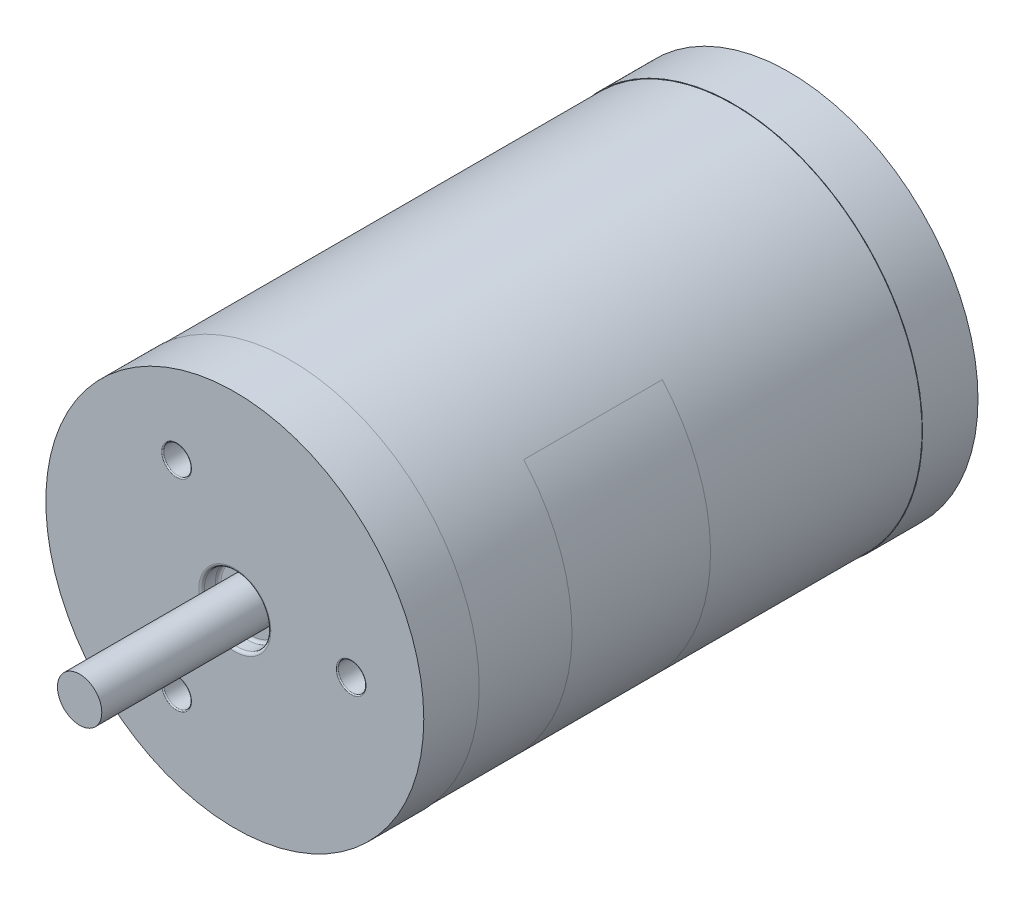
from build123d import *

# Parameters (mm, degrees)
CROQUIS1_R                 = 34
SALIENTE_EXTRUIR1_DEPTH    = 50
CROQUIS2_R                 = 4
SALIENTE_EXTRUIR2_DEPTH    = 28
CROQUIS3_R                 = 2.5
CORTAR_EXTRUIR1_DEPTH      = 5
CROQUIS4_R                 = 15
SALIENTE_EXTRUIR3_DEPTH    = 10.5
CROQUIS5_R                 = 2
CORTAR_EXTRUIR2_DEPTH      = 10.5
CROQUIS6_R                 = 34.1
CROQUIS6_R_2               = 2.5
SALIENTE_EXTRUIR4_DEPTH    = 10
REDONDEO1_R                = 1
CORTAR_EXTRUIR3_DEPTH      = 5
CORTAR_EXTRUIR3_DEPTH_BACK = 5
CROQUIS8_W                 = 18.660748896
CROQUIS8_H                 = 10.045403252
CROQUIS9_R                 = 2
CORTAR_EXTRUIR4_DEPTH      = 5
CORTAR_EXTRUIR5_START      = -3
CROQUIS10_R                = 6
CROQUIS10_R_2              = 4
CORTAR_EXTRUIR5_DEPTH      = 3
REDONDEO2_R                = 0.5
REDONDEO3_R                = 0.5
REDONDEO4_R                = 0.2


with BuildPart() as part:
    # Croquis1 → Saliente-Extruir1 (new, symmetric)
    with BuildSketch(Plane.XY):
        Circle(CROQUIS1_R)
    extrude(amount=SALIENTE_EXTRUIR1_DEPTH, both=True)

    # Croquis2 → Saliente-Extruir2 (add)
    with BuildSketch(Plane.XY.offset(50)):
        Circle(CROQUIS2_R)
    extrude(amount=SALIENTE_EXTRUIR2_DEPTH)

    # Croquis3 → Cortar-Extruir1 (cut)
    with BuildSketch(Plane.XY.offset(50)):
        with Locations((21, 0)):
            Circle(CROQUIS3_R)
        with Locations((-10.5, -18.186533479)):
            Circle(CROQUIS3_R)
        with Locations((-10.5, 18.186533479)):
            Circle(CROQUIS3_R)
    extrude(amount=-CORTAR_EXTRUIR1_DEPTH, mode=Mode.SUBTRACT)

    # Croquis4 → Saliente-Extruir3 (add)
    with BuildSketch(Plane(origin=(0, 0, -50), x_dir=(-1, 0, 0), z_dir=(0, 0, -1))):
        Circle(CROQUIS4_R)
    extrude(amount=SALIENTE_EXTRUIR3_DEPTH)

    # Croquis5 → Cortar-Extruir2 (cut)
    with BuildSketch(Plane(origin=(0, 0, -50), x_dir=(-1, 0, 0), z_dir=(0, 0, -1))):
        with Locations((-30, 0)):
            Circle(CROQUIS5_R)
        with Locations((30, 0)):
            Circle(CROQUIS5_R)
    extrude(amount=-CORTAR_EXTRUIR2_DEPTH, mode=Mode.SUBTRACT)

    # Croquis6 → Saliente-Extruir4 (add)
    with BuildSketch(Plane.XY.offset(50)):
        Circle(CROQUIS6_R)
        with Locations((21, 0)):
            Circle(CROQUIS6_R_2, mode=Mode.SUBTRACT)
        with Locations((-10.5, -18.186533479)):
            Circle(CROQUIS6_R_2, mode=Mode.SUBTRACT)
        with Locations((-10.5, 18.186533479)):
            Circle(CROQUIS6_R_2, mode=Mode.SUBTRACT)
    saliente_extruir4 = extrude(amount=-SALIENTE_EXTRUIR4_DEPTH)

    # Simetría1: Saliente-Extruir4 across plane
    add(saliente_extruir4.mirror(Plane.XY))

    # Redondeo1
    redondeo1_edges = [part.edges().sort_by_distance(p)[0] for p in [
        (15, 0, -60.5),
    ]]
    fillet(redondeo1_edges, radius=REDONDEO1_R)

    # Croquis8 → Cortar-Extruir3 (cut, two sides: drawn at the far end of the back side and taken through both)
    with BuildSketch(Plane(origin=(0, -34, 0), x_dir=(-1, 0, 0), z_dir=(0, -1, 0)).offset(-CORTAR_EXTRUIR3_DEPTH_BACK)):
        with Locations((0, -38.527445352)):
            Rectangle(CROQUIS8_W, CROQUIS8_H)
    extrude(amount=CORTAR_EXTRUIR3_DEPTH + CORTAR_EXTRUIR3_DEPTH_BACK, mode=Mode.SUBTRACT)

    # Croquis9 → Cortar-Extruir4 (cut)
    with BuildSketch(Plane(origin=(0, 0, -50), x_dir=(-1, 0, 0), z_dir=(0, 0, -1))):
        with Locations((30, 0)):
            Circle(CROQUIS9_R)
        with Locations((-30, 0)):
            Circle(CROQUIS9_R)
    extrude(amount=-CORTAR_EXTRUIR4_DEPTH, mode=Mode.SUBTRACT)

    # Croquis10 → Cortar-Extruir5 (cut)
    with BuildSketch(Plane.XY.offset(50).offset(CORTAR_EXTRUIR5_START)):
        Circle(CROQUIS10_R)
        Circle(CROQUIS10_R_2, mode=Mode.SUBTRACT)
    extrude(amount=CORTAR_EXTRUIR5_DEPTH, mode=Mode.SUBTRACT)

    # Redondeo2
    redondeo2_edges = [part.edges().sort_by_distance(p)[0] for p in [
        (-6, 0, 50),
    ]]
    fillet(redondeo2_edges, radius=REDONDEO2_R)

    # Redondeo3
    redondeo3_edges = [part.edges().sort_by_distance(p)[0] for p in [
        (-6, 0, 47),
    ]]
    fillet(redondeo3_edges, radius=REDONDEO3_R)

    # Redondeo4
    redondeo4_edges = [part.edges().sort_by_distance(p)[0] for p in [
        (-13, 18.186533479, 50),
        (18.5, 0, 50),
        (-13, -18.186533479, 50),
    ]]
    fillet(redondeo4_edges, radius=REDONDEO4_R)


solid = part.part
